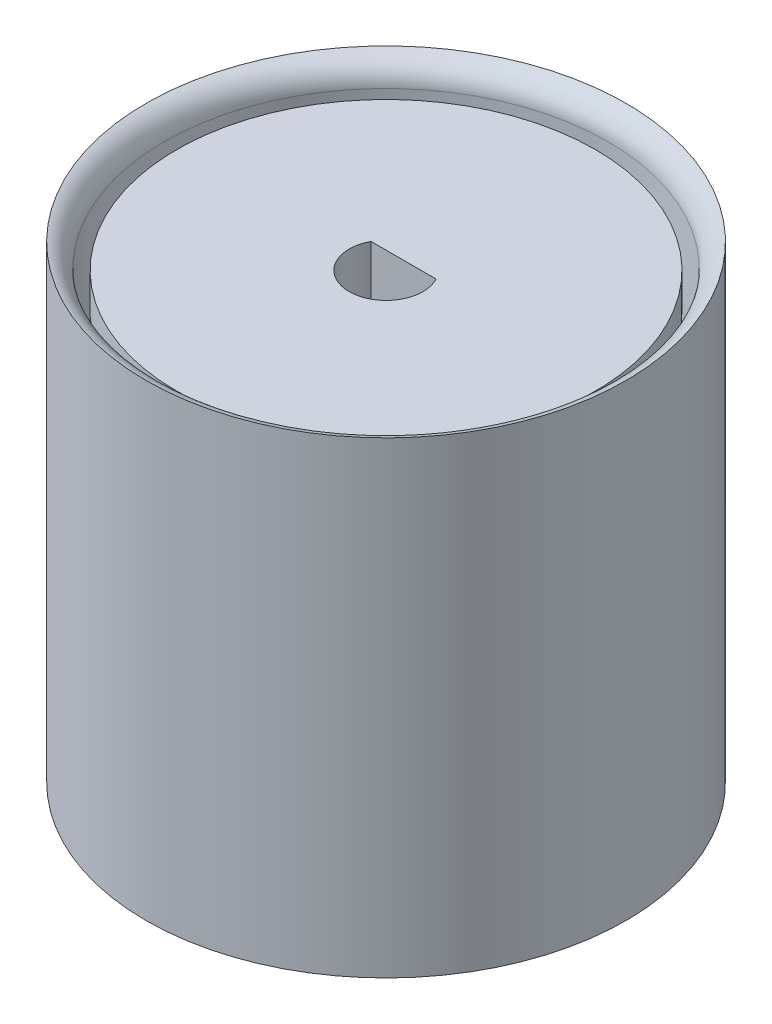
from build123d import *

# Parameters (mm, degrees)
SKETCH1_R                = 17
BOSS_EXTRUDE1_DEPTH      = 3
SKETCH3_R                = 17
BOSS_EXTRUDE2_DEPTH      = 3
BOSS_EXTRUDE3_DEPTH      = 31
CUT_EXTRUDE11_DEPTH      = 60
CUT_EXTRUDE11_DEPTH_BACK = 50
SKETCH7_R                = 1.751351815
CUT_EXTRUDE1_DEPTH       = 50
SKETCH8_W                = 7.5
SKETCH8_H                = 2
CUT_EXTRUDE12_DEPTH      = 30
SKETCH9_R                = 19.5
SKETCH9_R_2              = 18
BOSS_EXTRUDE4_DEPTH      = 38
FILLET1_R                = 2
SKETCH10_R               = 19.500000009
SKETCH10_R_2             = 17.00000001
BOSS_EXTRUDE5_DEPTH      = 3


with BuildPart() as part:
    # Sketch1 → Boss-Extrude1 (new body)
    with BuildSketch(Plane(origin=(0, -15, 0), x_dir=(1, 0, 0), z_dir=(0, 1, 0))):
        with Locations(Location((0, 0, 0), (0, 0, 270))):
            Circle(SKETCH1_R)
    extrude(amount=BOSS_EXTRUDE1_DEPTH)



with BuildPart() as body_2:
    # Sketch3 → Boss-Extrude2 (new body)
    with BuildSketch(Plane(origin=(0, 21, 0), x_dir=(1, 0, 0), z_dir=(0, 1, 0))):
        with Locations(Location((0, 0, 0), (0, 0, 270))):
            Circle(SKETCH3_R)
    extrude(amount=-BOSS_EXTRUDE2_DEPTH)


with BuildPart() as part_1:
    add(part.part)

    add(body_2.part)  # Boss-Extrude3 merges body 2
    # Sketch6 → Boss-Extrude3 (add)
    with BuildSketch(Plane(origin=(0, -12, 0), x_dir=(1, 0, 0), z_dir=(0, 1, 0))):
        Polygon((-10.39609313, -6.860559341), (-11.68775931, -8.152225055), (-12.244775891, -7.288892753), (-12.738139369, -6.387668662), (-13.165283017, -5.453239195), (-13.523988426, -4.490460269), (-13.812389225, -3.504338907), (-14.028987847, -2.499999944), (-12.202296406, -2.499999944), (-12.202296406, 2.499999944), (-14.028987847, 2.499999944), (-13.812389225, 3.504338907), (-13.523988426, 4.490460269), (-13.165283017, 5.453239195), (-12.738139369, 6.387668662), (-12.244775891, 7.288892753), (-11.68775931, 8.152225055), (-10.39609313, 6.860559341), (-6.860559341, 10.39609313), (-8.152225055, 11.68775931), (-7.288892753, 12.244775891), (-6.387668662, 12.738139369), (-5.453239195, 13.165283017), (-4.490460269, 13.523988426), (-3.504338907, 13.812389225), (-2.499999944, 14.028987847), (-2.499999944, 12.174172863), (2.499999944, 12.202296406), (2.499999944, 14.028987847), (3.504338907, 13.812389225), (4.490460269, 13.523988426), (5.453239195, 13.165283017), (6.387668662, 12.738139369), (7.288892753, 12.244775891), (8.152225055, 11.68775931), (6.860559341, 10.39609313), (10.39609313, 6.860559341), (11.68775931, 8.152225055), (12.244775891, 7.288892753), (12.738139369, 6.387668662), (13.165283017, 5.453239195), (13.523988426, 4.490460269), (13.812389225, 3.504338907), (14.028987847, 2.499999944), (12.202296406, 2.499999944), (12.202296406, -2.499999944), (14.028987847, -2.499999944), (13.812389225, -3.504338907), (13.523988426, -4.490460269), (13.165283017, -5.453239195), (12.738139369, -6.387668662), (12.244775891, -7.288892753), (11.68775931, -8.152225055), (10.39609313, -6.860559341), (6.860559341, -10.39609313), (8.152225055, -11.68775931), (7.288892753, -12.244775891), (6.387668662, -12.738139369), (5.453239195, -13.165283017), (4.490460269, -13.523988426), (3.504338907, -13.812389225), (2.499999944, -14.028987847), (2.499999944, -12.202296406), (-2.499999944, -12.202296406), (-2.499999944, -14.028987847), (-3.504338907, -13.812389225), (-4.490460269, -13.523988426), (-5.453239195, -13.165283017), (-6.387668662, -12.738139369), (-7.288892753, -12.244775891), (-8.152225055, -11.68775931), (-6.860559341, -10.39609313), align=None)
    extrude(amount=BOSS_EXTRUDE3_DEPTH)

    # Sketch7 → Cut-Extrude11 (cut, two sides: drawn at the far end of the back side and taken through both)
    with BuildSketch(Plane(origin=(-0.068553102, 0, -12.187849043), x_dir=(-0.9999841817006155, 0, 0.005624619858302935), z_dir=(-0.005624619858302935, 0, -0.9999841817006155)).offset(-CUT_EXTRUDE11_DEPTH_BACK)):
        with Locations(Location((-0.120761258, 1.306302196, 0), (0, 0, 180))):
            Circle(SKETCH7_R)
    extrude(amount=CUT_EXTRUDE11_DEPTH + CUT_EXTRUDE11_DEPTH_BACK, mode=Mode.SUBTRACT)

    # Sketch2 → Cut-Extrude1 (cut)
    with BuildSketch(Plane(origin=(0, -15, 0), x_dir=(1, 0, 0), z_dir=(0, 1, 0))):
        with BuildLine():
            Line((2.642344683, 1.420568442), (-2.642344683, 1.420568442))
            ThreePointArc((-2.642344683, 1.420568442), (0, -2.999999869), (2.642344683, 1.420568442))
        make_face()
    extrude(amount=CUT_EXTRUDE1_DEPTH, mode=Mode.SUBTRACT)

    # Sketch8 → Cut-Extrude12 (cut)
    with BuildSketch(Plane(origin=(0, -15, 0), x_dir=(1, 0, 0), z_dir=(0, 1, 0))):
        with Locations((-0.237061367, 10.505385433)):
            Rectangle(SKETCH8_W, SKETCH8_H)
    cut_extrude12 = extrude(amount=CUT_EXTRUDE12_DEPTH, mode=Mode.SUBTRACT)

    # Mirror1: Cut-Extrude12 across plane
    add(cut_extrude12.mirror(Plane.XY), mode=Mode.SUBTRACT)



with BuildPart() as body_2_2:
    # Sketch9 → Boss-Extrude4 (new body)
    with BuildSketch(Plane(origin=(0, -15, 0), x_dir=(1, 0, 0), z_dir=(0, 1, 0))):
        with Locations(Location((0, 0, 0), (0, 0, 270))):
            Circle(SKETCH9_R)
        with Locations(Location((0, 0, 0), (0, 0, 270))):
            Circle(SKETCH9_R_2, mode=Mode.SUBTRACT)
    extrude(amount=BOSS_EXTRUDE4_DEPTH)

    # Fillet1
    # the kernel refuses this fillet: 2 mm, written as the material it takes off along each edge
    with BuildSketch(Plane(origin=(0, 23, 0), x_dir=(0, 0, 1), z_dir=(-1, 0, 0))) as fillet1_piece_1:
        with BuildLine():
            CenterArc((20, -1.936491673), FILLET1_R, 104.477512186, 75.522487814)
            Line((19.5, 0), (19.49, 0.038729833))
            ThreePointArc((19.49, 0.038729833), (18.75, 0.04), (18, 0.04))
            Line((18, 0.04), (17.96, 0))
            Line((17.96, 0), (17.96, -1.936491673))
            Line((17.96, -1.936491673), (18, -1.936491673))
        make_face()
    revolve(axis=Axis((0, 23, 0), (0, 1, 0)), mode=Mode.SUBTRACT)


with BuildPart() as part_2:
    add(part_1.part)

    add(body_2_2.part)  # Boss-Extrude5 merges body 2 2
    # Sketch10 → Boss-Extrude5 (add)
    with BuildSketch(Plane(origin=(0, -15, 0), x_dir=(1, 0, 0), z_dir=(0, 1, 0))):
        with Locations(Location((0, 1.03e-07, 0), (0, 0, 270))):
            Circle(SKETCH10_R)
        with Locations(Location((0, 1.03e-07, 0), (0, 0, 270))):
            Circle(SKETCH10_R_2, mode=Mode.SUBTRACT)
    extrude(amount=BOSS_EXTRUDE5_DEPTH)


solid = part_2.part
